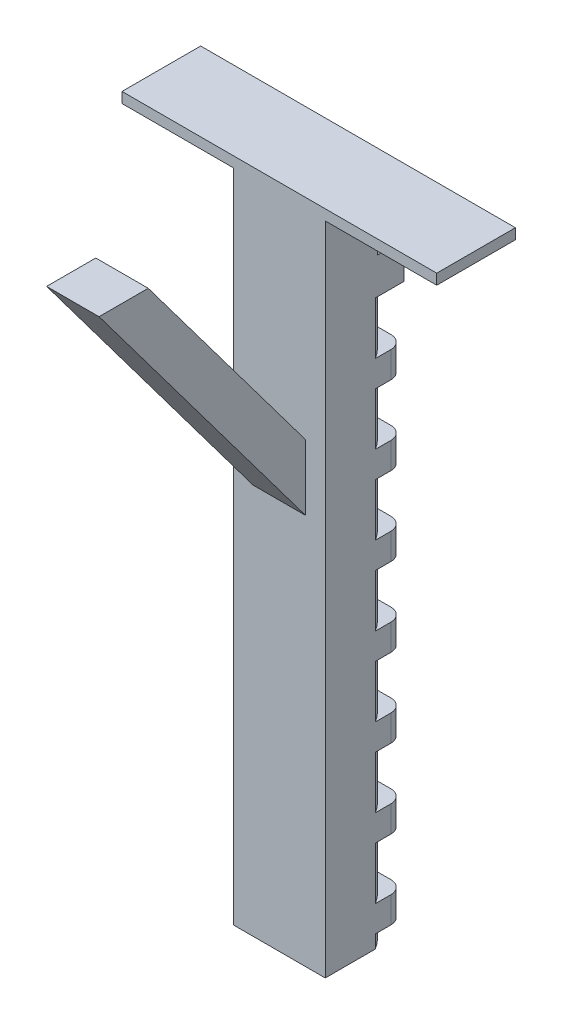
from build123d import *

# Parameters (mm, degrees)
SKETCH1_W                = 35
SKETCH1_H                = 250
BOSS_EXTRUDE1_DEPTH      = 30
SKETCH2_W                = 120
SKETCH2_H                = 4
BOSS_EXTRUDE2_DEPTH      = 30
BOSS_EXTRUDE3_DEPTH      = 10
CUT_EXTRUDE1_DEPTH       = 20
LPATTERN1_COUNT          = 5
LPATTERN1_PITCH          = 30
LPATTERN1_COUNT_DIR2     = 4
LPATTERN1_PITCH_DIR2     = 30
FILLET1_R                = 5
BOSS_EXTRUDE4_DEPTH      = 10
BOSS_EXTRUDE4_DEPTH_BACK = 10


with BuildPart() as part:
    # Sketch1 → Boss-Extrude1 (new body)
    with BuildSketch(Plane.XY):
        Rectangle(SKETCH1_W, SKETCH1_H)
    extrude(amount=BOSS_EXTRUDE1_DEPTH)

    # Sketch2 → Boss-Extrude2 (add)
    with BuildSketch(Plane.XY):
        with Locations((0, 127)):
            Rectangle(SKETCH2_W, SKETCH2_H)
    extrude(amount=BOSS_EXTRUDE2_DEPTH)

    # Sketch4 → Boss-Extrude3 (add)
    with BuildSketch(Plane.XY):
        Polygon((-38.75, 125), (-17.5, 103.75), (-17.5, 125), align=None)
        Polygon((38.75, 125), (17.5, 125), (17.5, 103.75), align=None)
    extrude(amount=BOSS_EXTRUDE3_DEPTH)

    # Sketch5 → Cut-Extrude1 (cut)
    with BuildSketch(Plane(origin=(0, 0, 0), x_dir=(1, 0, 0), z_dir=(0, 1, 0))):
        with BuildLine():
            Line((17.5, 0), (-17.5, 0))
            Line((-17.5, 0), (-17.5, -10.91831043))
            ThreePointArc((-17.5, -10.91831043), (0, -1.037414693), (17.5, -10.91831043))
            Line((17.5, -10.91831043), (17.5, 0))
        make_face()
    cut_extrude1 = extrude(amount=-CUT_EXTRUDE1_DEPTH, mode=Mode.SUBTRACT)

    # LPattern1: Cut-Extrude1 5 × 4
    with Locations(*[Vector(0, -1, 0) * (i * LPATTERN1_PITCH) + Vector(0, 1, 0) * (j * LPATTERN1_PITCH_DIR2) for i in range(LPATTERN1_COUNT) for j in range(LPATTERN1_COUNT_DIR2) if (i, j) != (0, 0)]):
        add(cut_extrude1, mode=Mode.SUBTRACT)

    # Fillet1
    fillet1_edges = [part.edges().sort_by_distance(p)[0] for p in [
        (-17.5, 65, 0),
        (17.5, 65, 0),
        (17.5, 35, 0),
        (17.5, 5, 0),
        (17.5, -25, 0),
        (17.5, -55, 0),
        (17.5, -85, 0),
        (17.5, -115, 0),
        (-17.5, 35, 0),
        (-17.5, 5, 0),
        (-17.5, -25, 0),
        (-17.5, -55, 0),
        (-17.5, -85, 0),
        (-17.5, -115, 0),
    ]]
    fillet(fillet1_edges, radius=FILLET1_R)

    # Sketch6 → Boss-Extrude4 (add, two sides: drawn at the far end of the back side and taken through both)
    with BuildSketch(Plane(origin=(0, 0, 0), x_dir=(0, 0, -1), z_dir=(1, 0, 0)).offset(-BOSS_EXTRUDE4_DEPTH_BACK)):
        Polygon((-30, 49), (-90, 129), (-108.75, 129), (-30, 24), align=None)
    extrude(amount=BOSS_EXTRUDE4_DEPTH + BOSS_EXTRUDE4_DEPTH_BACK)


solid = part.part
